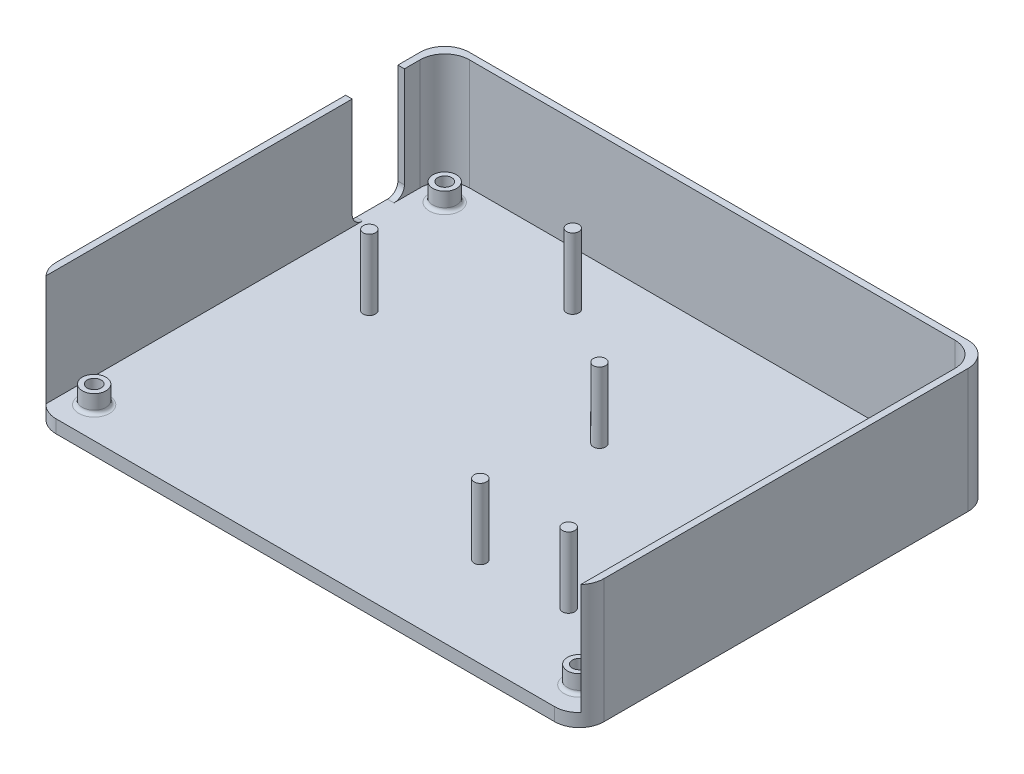
from build123d import *

# Parameters (mm, degrees)
BOSS_EXTRUDE12_DEPTH = 3.175
BOSS_EXTRUDE13_DEPTH = 30.1625
SKETCH1_25_R         = 2.875
SKETCH1_25_R_2       = 1.7
BOSS_EXTRUDE15_DEPTH = 7.525
SKETCH1_27_R         = 1.7
CUT_EXTRUDE3_DEPTH   = 28.575
CHAMFER2_SIZE        = 1.45
SKETCH1_28_R         = 1.5
BOSS_EXTRUDE16_DEPTH = 20.32
FILLET3_R            = 6
FILLET4_R            = 0.85
FILLET5_R            = 0.85
SKETCH2_W            = 12.7
SKETCH2_H            = 26.9875
CUT_EXTRUDE4_DEPTH   = 2.54
FILLET6_R            = 2.54


with BuildPart() as part:
    # Sketch1 → Boss-Extrude12 (new body)
    with BuildSketch(Plane(origin=(0, 0, 0), x_dir=(1, 0, 0), z_dir=(0, 1, 0))):
        with BuildLine():
            Line((-66.858315384, -50.276221126), (-65.270815384, -50.276221126))
            Line((-65.270815384, -50.276221126), (64.85543465, -50.276221126))
            Line((64.85543465, -50.276221126), (66.44293465, -50.276221126))
            Line((66.44293465, -50.276221126), (66.44293465, 44.266274766))
            ThreePointArc((66.44293465, 44.266274766), (64.685575338, 48.508915454), (60.44293465, 50.266274766))
            Line((60.44293465, 50.266274766), (-60.858315384, 50.266274766))
            ThreePointArc((-60.858315384, 50.266274766), (-65.100956071, 48.508915454), (-66.858315384, 44.266274766))
            Line((-66.858315384, 44.266274766), (-66.858315384, -50.276221126))
        make_face()
    extrude(amount=BOSS_EXTRUDE12_DEPTH)

    # Sketch1<23> → Boss-Extrude13 (add)
    with BuildSketch(Plane(origin=(0, 0, 0), x_dir=(1, 0, 0), z_dir=(0, 1, 0))):
        with BuildLine():
            Line((-66.858315384, 44.266274766), (-66.858315384, -50.276221126))
            Line((-66.858315384, -50.276221126), (-65.270815384, -50.276221126))
            Line((-65.270815384, -50.276221126), (-65.270815384, 42.678774766))
            ThreePointArc((-65.270815384, 42.678774766), (-63.513456071, 46.921415454), (-59.270815384, 48.678774766))
            Line((-59.270815384, 48.678774766), (58.85543465, 48.678774766))
            ThreePointArc((58.85543465, 48.678774766), (63.098075338, 46.921415454), (64.85543465, 42.678774766))
            Line((64.85543465, 42.678774766), (64.85543465, -50.276221126))
            Line((64.85543465, -50.276221126), (66.44293465, -50.276221126))
            Line((66.44293465, -50.276221126), (66.44293465, 44.266274766))
            ThreePointArc((66.44293465, 44.266274766), (64.685575338, 48.508915454), (60.44293465, 50.266274766))
            Line((60.44293465, 50.266274766), (-60.858315384, 50.266274766))
            ThreePointArc((-60.858315384, 50.266274766), (-65.100956071, 48.508915454), (-66.858315384, 44.266274766))
        make_face()
    extrude(amount=BOSS_EXTRUDE13_DEPTH)

    # Sketch1<25> → Boss-Extrude15 (add)
    # profile 1 of 4: a face of its own
    with BuildSketch(Plane(origin=(0, 0, 0), x_dir=(1, 0, 0), z_dir=(0, 1, 0))):
        with Locations((-59.238315384, 42.646274766)):
            Circle(SKETCH1_25_R)
        with Locations((-59.238315384, 42.646274766)):
            Circle(SKETCH1_25_R_2, mode=Mode.SUBTRACT)
    # profile 2 of 4: a face of its own
    with BuildSketch(Plane(origin=(0, 0, 0), x_dir=(1, 0, 0), z_dir=(0, 1, 0))):
        with Locations((58.82293465, 42.646274766)):
            Circle(SKETCH1_25_R)
        with Locations((58.82293465, 42.646274766)):
            Circle(SKETCH1_25_R_2, mode=Mode.SUBTRACT)
    # profile 3 of 4: a face of its own
    with BuildSketch(Plane(origin=(0, 0, 0), x_dir=(1, 0, 0), z_dir=(0, 1, 0))):
        with Locations((-59.238315384, -42.656221126)):
            Circle(SKETCH1_25_R)
        with Locations((-59.238315384, -42.656221126)):
            Circle(SKETCH1_25_R_2, mode=Mode.SUBTRACT)
    # profile 4 of 4: a face of its own
    with BuildSketch(Plane(origin=(0, 0, 0), x_dir=(1, 0, 0), z_dir=(0, 1, 0))):
        with Locations((58.82293465, -42.656221126)):
            Circle(SKETCH1_25_R)
        with Locations((58.82293465, -42.656221126)):
            Circle(SKETCH1_25_R_2, mode=Mode.SUBTRACT)
    extrude(amount=BOSS_EXTRUDE15_DEPTH)

    # Sketch1<27> → Cut-Extrude3 (cut)
    with BuildSketch(Plane(origin=(0, 0, 0), x_dir=(1, 0, 0), z_dir=(0, 1, 0))):
        with Locations((-59.238315384, 42.646274766)):
            Circle(SKETCH1_27_R)
        with Locations((58.82293465, 42.646274766)):
            Circle(SKETCH1_27_R)
        with Locations((-59.238315384, -42.656221126)):
            Circle(SKETCH1_27_R)
        with Locations((58.82293465, -42.656221126)):
            Circle(SKETCH1_27_R)
    extrude(amount=CUT_EXTRUDE3_DEPTH, mode=Mode.SUBTRACT)

    # Chamfer2
    chamfer2_edges = [part.edges().sort_by_distance(p)[0] for p in [
        (57.12293465, 0, 42.656221126),
        (57.12293465, 0, -42.646274766),
        (-60.938315384, 0, 42.656221126),
        (-60.938315384, 0, -42.646274766),
    ]]
    chamfer(chamfer2_edges, length=CHAMFER2_SIZE)

    # Sketch1<28> → Boss-Extrude16 (add)
    with BuildSketch(Plane(origin=(0, 0, 0), x_dir=(1, 0, 0), z_dir=(0, 1, 0))):
        with Locations((-21.087205302, 35.652944211)):
            Circle(SKETCH1_28_R)
        with Locations((20.412794756, -28.347055805)):
            Circle(SKETCH1_28_R)
        with Locations((-45.587205324, 10.652944173)):
            Circle(SKETCH1_28_R)
        with Locations((10.41279469, 10.652944173)):
            Circle(SKETCH1_28_R)
        with Locations((41.412794666, -27.847055789)):
            Circle(SKETCH1_28_R)
    extrude(amount=BOSS_EXTRUDE16_DEPTH)

    # Fillet3
    fillet3_edges = [part.edges().sort_by_distance(p)[0] for p in [
        (66.44293465, 15.08125, 50.276221126),
        (-66.858315384, 15.08125, 50.276221126),
    ]]
    fillet(fillet3_edges, radius=FILLET3_R)

    # Fillet4
    fillet4_edges = [part.edges().sort_by_distance(p)[0] for p in [
        (-62.113315384, 3.175, -42.646274766),
    ]]
    fillet(fillet4_edges, radius=FILLET4_R)

    # Fillet5
    fillet5_edges = [part.edges().sort_by_distance(p)[0] for p in [
        (-62.113315384, 3.175, 42.656221126),
        (55.94793465, 3.175, 42.656221126),
        (55.94793465, 3.175, -42.646274766),
    ]]
    fillet(fillet5_edges, radius=FILLET5_R)

    # Sketch2 → Cut-Extrude4 (cut)
    with BuildSketch(Plane(origin=(-65.270815384, 0, 0), x_dir=(0, 0, -1), z_dir=(1, 0, 0))):
        with Locations((32.519846941, 16.66875)):
            Rectangle(SKETCH2_W, SKETCH2_H)
    extrude(amount=-CUT_EXTRUDE4_DEPTH, mode=Mode.SUBTRACT)

    # Fillet6
    fillet6_edges = [part.edges().sort_by_distance(p)[0] for p in [
        (-66.064565384, 3.175, -38.869846941),
        (-66.064565384, 3.175, -26.169846941),
    ]]
    fillet(fillet6_edges, radius=FILLET6_R)


solid = part.part
